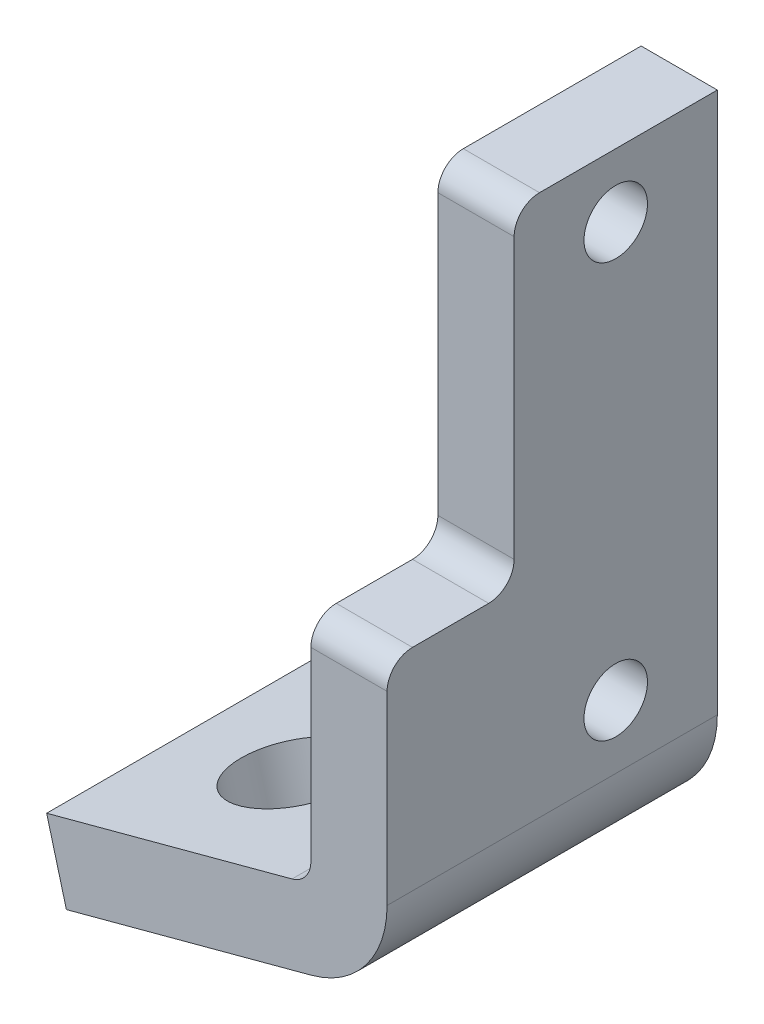
from build123d import *

# Parameters (mm, degrees)
BOSS_EXTRUDE2_DEPTH = 13
SKETCH7_R           = 2.25
CUT_EXTRUDE4_DEPTH  = 29.005289616
SKETCH6_R           = 1.25
SKETCH6_W           = 5
SKETCH6_H           = 13
CUT_EXTRUDE5_DEPTH  = 27.253745179
FILLET2_R           = 1


with BuildPart() as part:
    # Sketch2 → Boss-Extrude2 (new body)
    with BuildSketch(Plane.XY):
        with BuildLine():
            Line((-2.241180955, -1.965925826), (-11.900439218, -4.554116277))
            Line((-11.900439218, -4.554116277), (-11.123982082, -7.451893756))
            Line((-11.123982082, -7.451893756), (-1.46472382, -4.863703305))
            ThreePointArc((-1.46472382, -4.863703305), (0.673413361, -3.435045716), (1.5, -1))
            Line((1.5, -1), (1.5, 20.3))
            Line((1.5, 20.3), (-1.5, 20.3))
            Line((-1.5, 20.3), (-1.5, -1))
            ThreePointArc((-1.5, -1), (-1.70664666, -1.608761429), (-2.241180955, -1.965925826))
        make_face()
    extrude(amount=BOSS_EXTRUDE2_DEPTH)

    # Sketch7 → Cut-Extrude4 (cut, through all)
    with BuildSketch(Plane(origin=(0.3413508, -1.273938528, 0), x_dir=(0.96592582628907, 0.2588190451025146, 0), z_dir=(-0.2588190451025145, 0.9659258262890699, 0))):
        with Locations((-7.673633611, -8)):
            Circle(SKETCH7_R)
    extrude(amount=-CUT_EXTRUDE4_DEPTH, mode=Mode.SUBTRACT)

    # Sketch6 → Cut-Extrude5 (cut, through all)
    with BuildSketch(Plane.ZY.offset(1.5)):
        with Locations((4, 17.8)):
            Circle(SKETCH6_R)
        with Locations((4, 1.5)):
            Circle(SKETCH6_R)
        with Locations((10.5, 13.8)):
            Rectangle(SKETCH6_W, SKETCH6_H)
    extrude(amount=-CUT_EXTRUDE5_DEPTH, mode=Mode.SUBTRACT)

    # Fillet2
    fillet2_edges = [part.edges().sort_by_distance(p)[0] for p in [
        (0, 7.3, 13),
        (0, 7.3, 8),
        (0, 20.3, 8),
    ]]
    fillet(fillet2_edges, radius=FILLET2_R)


solid = part.part
